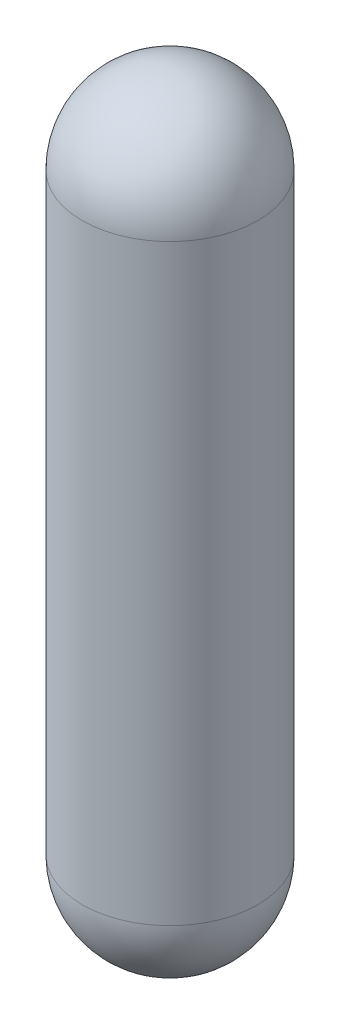
from build123d import *


with BuildPart() as part:
    # Sketch1 → Revolve1 (revolve)
    with BuildSketch(Plane.XY):
        with BuildLine():
            Line((0, 1542.8), (0, 1771.4))
            ThreePointArc((0, 1771.4), (161.644610179, 1704.444610179), (228.6, 1542.8))
            Line((228.6, 1542.8), (228.6, 0))
            ThreePointArc((228.6, 0), (161.644610179, -161.644610179), (0, -228.6))
            Line((0, -228.6), (0, 0))
            Line((0, 0), (0, 1542.8))
        make_face()
    revolve(axis=Axis((0, 0, 0), (0, 1, 0)))


solid = part.part
